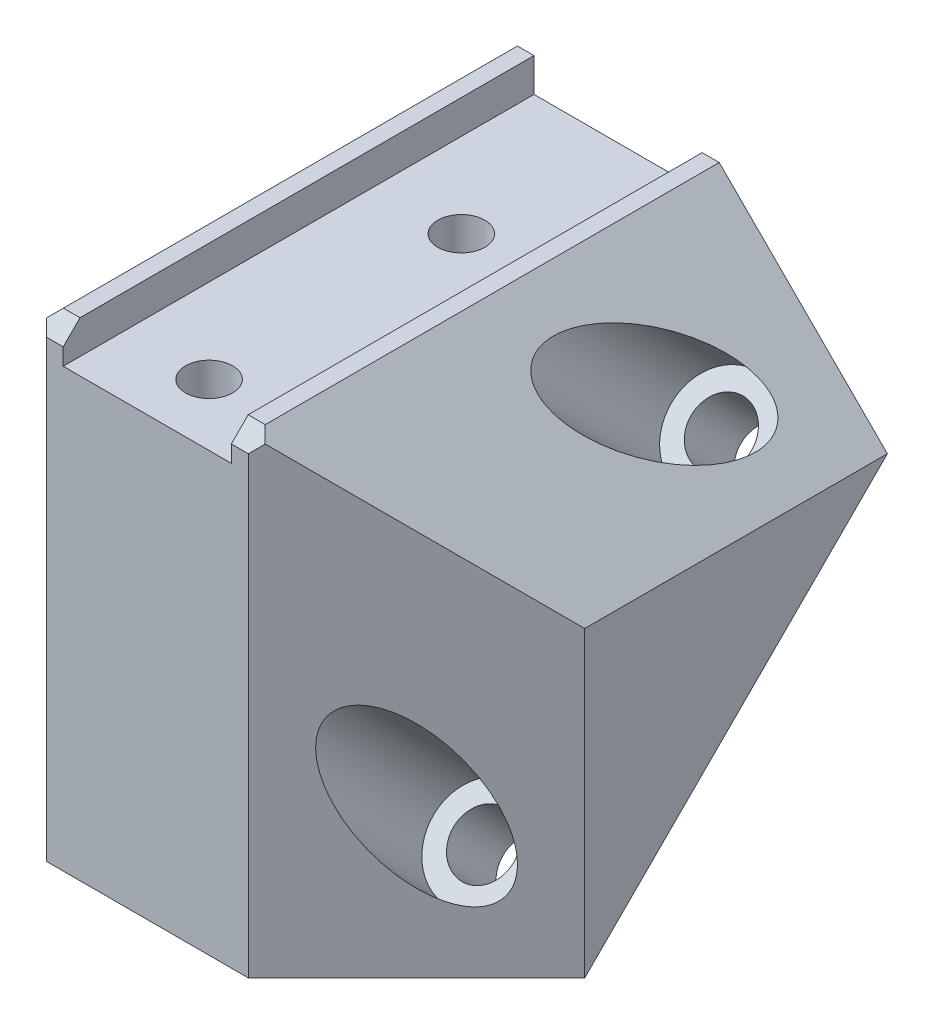
from build123d import *

# Parameters (mm, degrees)
SKETCH1_W           = 28
SKETCH1_H           = 28
BOSS_EXTRUDE1_DEPTH = 32
CHAMFER1_SIZE       = 18
SKETCH2_R           = 1.4
CUT_EXTRUDE1_DEPTH  = 5.5
CHAMFER2_SIZE       = 1
SKETCH3_R           = 1.8
CUT_EXTRUDE2_DEPTH  = 42.785164832
SKETCH4_R           = 3
CUT_EXTRUDE3_DEPTH  = 22
CHAMFER3_SIZE       = 10
SKETCH5_W           = 10
SKETCH5_H           = 28
CUT_EXTRUDE4_DEPTH  = 2


with BuildPart() as part:
    # Sketch1 → Boss-Extrude1 (new body)
    with BuildSketch(Plane(origin=(0, 0, 0), x_dir=(0, 0, -1), z_dir=(1, 0, 0))):
        with Locations((-14, 14)):
            Rectangle(SKETCH1_W, SKETCH1_H)
    extrude(amount=BOSS_EXTRUDE1_DEPTH)

    # Chamfer1
    chamfer1_edges = [part.edges().sort_by_distance(p)[0] for p in [
        (16, 0, 0),
    ]]
    chamfer(chamfer1_edges, length=CHAMFER1_SIZE)

    # Sketch2 → Cut-Extrude1 (cut)
    with BuildSketch(Plane(origin=(0, 28, 0), x_dir=(1, 0, 0), z_dir=(0, 1, 0))):
        with Locations(Location((16, -9.337953515, 0), (0, 0, 270))):
            Circle(SKETCH2_R)
        with Locations(Location((16, -24.337953515, 0), (0, 0, 270))):
            Circle(SKETCH2_R)
    extrude(amount=-CUT_EXTRUDE1_DEPTH, mode=Mode.SUBTRACT)

    # Chamfer2
    chamfer2_edges = [part.edges().sort_by_distance(p)[0] for p in [
        (16, 28, 28),
    ]]
    chamfer(chamfer2_edges, length=CHAMFER2_SIZE)

    # Sketch3 → Cut-Extrude2 (cut, through all)
    with BuildSketch(Plane(origin=(0, 9, 9), x_dir=(-1, 0, 0), z_dir=(0, -0.7071067811865487, -0.7071067811865465))):
        with Locations(Location((-5, -10, 0), (0, 0, 90))):
            Circle(SKETCH3_R)
        with Locations(Location((-27, -10, 0), (0, 0, 90))):
            Circle(SKETCH3_R)
        with Locations(Location((-27, 10, 0), (0, 0, 90))):
            Circle(SKETCH3_R)
        with Locations(Location((-5, 10, 0), (0, 0, 90))):
            Circle(SKETCH3_R)
    extrude(amount=-CUT_EXTRUDE2_DEPTH, mode=Mode.SUBTRACT)

    # Sketch4 → Cut-Extrude3 (cut)
    with BuildSketch(Plane(origin=(0, 27.5, 27.5), x_dir=(1, 0, 0), z_dir=(0, 0.7071067811865477, 0.7071067811865475))):
        with Locations(Location((5, 10, 0), (0, 0, 270))):
            Circle(SKETCH4_R)
        with Locations(Location((27, 10, 0), (0, 0, 270))):
            Circle(SKETCH4_R)
        with Locations(Location((27, -10, 0), (0, 0, 270))):
            Circle(SKETCH4_R)
        with Locations(Location((5, -10, 0), (0, 0, 270))):
            Circle(SKETCH4_R)
    extrude(amount=-CUT_EXTRUDE3_DEPTH, mode=Mode.SUBTRACT)

    # Chamfer3
    # the kernel refuses this chamfer: 10 mm, written as the material it takes off along each edge
    with BuildSketch(Plane(origin=(0, 28, 52.71682988), x_dir=(-0.027495876610586372, -0.9996219169112968, 0), z_dir=(0, 0, -1)), Plane(origin=(0, -25.71682988, 28), x_dir=(-0.027495876610586372, 0, -0.9996219169112968), z_dir=(0, 1, 0)), Plane(origin=(32, -25.71682988, 28), x_dir=(-0.9996219169112968, 0, 0.027495876610586317), z_dir=(0, 1, 0)), Plane(origin=(32, 28, 52.71682988), x_dir=(-0.9996219169112968, 0.027495876610586317, 0), z_dir=(0, 0, -1))) as chamfer3_piece_1:
        Polygon((CHAMFER3_SIZE * 0.999621916911, -CHAMFER3_SIZE * 0.0274958766106), (-CHAMFER3_SIZE * 0.0274958766106, -CHAMFER3_SIZE * 0.999621916911), (0, 0), align=None)
    extrude(amount=78.433659759, mode=Mode.SUBTRACT)

    # Sketch5 → Cut-Extrude4 (cut)
    with BuildSketch(Plane(origin=(0, 28, 0), x_dir=(1, 0, 0), z_dir=(0, 1, 0))):
        with Locations((15.986268974, -14)):
            Rectangle(SKETCH5_W, SKETCH5_H)
    extrude(amount=-CUT_EXTRUDE4_DEPTH, mode=Mode.SUBTRACT)


solid = part.part
